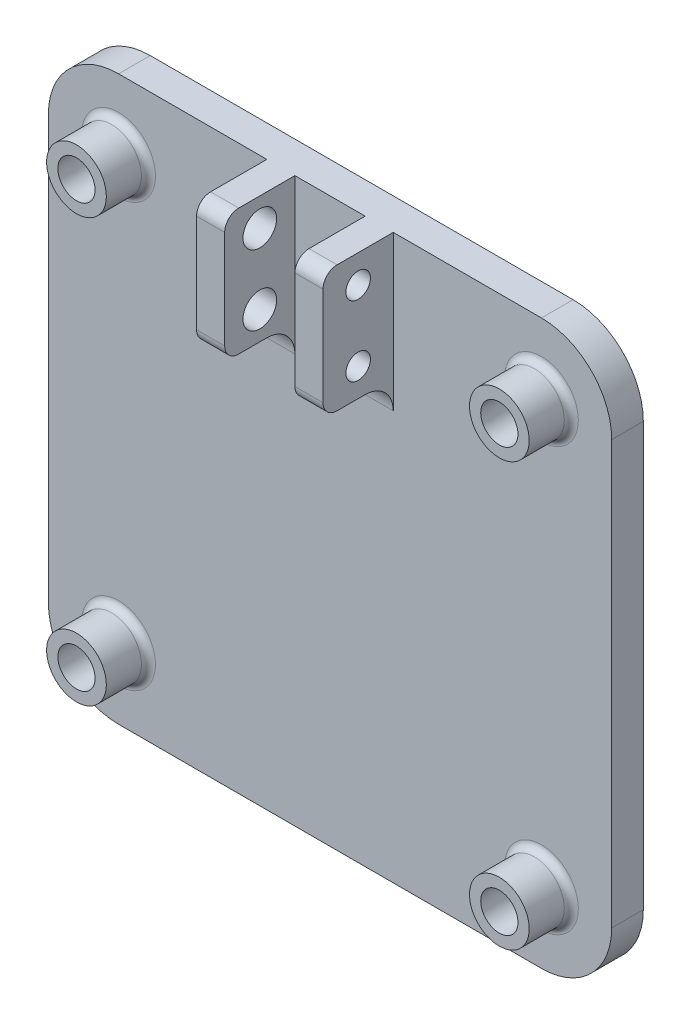
from build123d import *

# Parameters (mm, degrees)
SKETCH1_W            = 80.2
SKETCH1_H            = 80.2
BOSS_EXTRUDE1_DEPTH  = 4.5
M5_CLEARANCE_HOLE1_D = 5.3
FILLET1_R            = 10
SKETCH3_W            = 4
SKETCH3_H            = 18
BOSS_EXTRUDE2_DEPTH  = 10
CUT_EXTRUDE1_REACH   = 67.031
SKETCH5_R            = 1.75
CUT_EXTRUDE2_REACH   = 67.031
SKETCH6_R            = 2.4
FILLET2_R            = 2
FILLET3_R            = 4
BOSS_EXTRUDE3_START  = 6
SKETCH7_R            = 4.25
SKETCH7_R_2          = 2.65
BOSS_EXTRUDE3_DEPTH  = 6
FILLET5_R            = 1


with BuildPart() as part:
    # Sketch1 → Boss-Extrude1 (new body)
    with BuildSketch(Plane.XY):
        Rectangle(SKETCH1_W, SKETCH1_H)
    extrude(amount=BOSS_EXTRUDE1_DEPTH)

    # M5 Clearance Hole1 (through all)
    with Locations(Plane(origin=(30.1, 30.1, 0), x_dir=(-1, 0, 0), z_dir=(0, 0, -1))):
        with Locations((0, 0), (60.2, 0), (60.2, -60.2), (0, -60.2)):
            Hole(M5_CLEARANCE_HOLE1_D / 2)

    # Fillet1
    fillet1_edges = [part.edges().sort_by_distance(p)[0] for p in [
        (-40.1, 40.1, 2.25),
        (-40.1, -40.1, 2.25),
        (40.1, -40.1, 2.25),
        (40.1, 40.1, 2.25),
    ]]
    fillet(fillet1_edges, radius=FILLET1_R)

    # Sketch3 → Boss-Extrude2 (add)
    with BuildSketch(Plane.XY.offset(4.5)):
        with Locations((-7, 31.1)):
            Rectangle(SKETCH3_W, SKETCH3_H)
        with Locations((7, 31.1)):
            Rectangle(SKETCH3_W, SKETCH3_H)
    extrude(amount=BOSS_EXTRUDE2_DEPTH)

    # Sketch5 → Cut-Extrude1 (cut, up to next)
    with BuildSketch(Plane(origin=(9, 0, 0), x_dir=(0, 0, -1), z_dir=(1, 0, 0)), mode=Mode.PRIVATE) as cut_extrude1_sk1:
        with Locations((-9.5, 36.1)):
            Circle(SKETCH5_R)
    cut_extrude1_tool1 = extrude(cut_extrude1_sk1.sketch, amount=-CUT_EXTRUDE1_REACH, mode=Mode.PRIVATE) & part.part
    # Sketch5 → Cut-Extrude1 (cut, up to next)
    with BuildSketch(Plane(origin=(9, 0, 0), x_dir=(0, 0, -1), z_dir=(1, 0, 0)), mode=Mode.PRIVATE) as cut_extrude1_sk2:
        with Locations((-9.5, 26.1)):
            Circle(SKETCH5_R)
    cut_extrude1_tool2 = extrude(cut_extrude1_sk2.sketch, amount=-CUT_EXTRUDE1_REACH, mode=Mode.PRIVATE) & part.part
    add(cut_extrude1_tool1.solids().sort_by_distance((9, 36.1, 9.5))[0], mode=Mode.SUBTRACT)
    add(cut_extrude1_tool2.solids().sort_by_distance((9, 26.1, 9.5))[0], mode=Mode.SUBTRACT)

    # Sketch6 → Cut-Extrude2 (cut, up to next)
    with BuildSketch(Plane.ZY.offset(9), mode=Mode.PRIVATE) as cut_extrude2_sk1:
        with Locations((9.5, 36.1)):
            Circle(SKETCH6_R)
    cut_extrude2_tool1 = extrude(cut_extrude2_sk1.sketch, amount=-CUT_EXTRUDE2_REACH, mode=Mode.PRIVATE) & part.part
    # Sketch6 → Cut-Extrude2 (cut, up to next)
    with BuildSketch(Plane.ZY.offset(9), mode=Mode.PRIVATE) as cut_extrude2_sk2:
        with Locations((9.5, 26.1)):
            Circle(SKETCH6_R)
    cut_extrude2_tool2 = extrude(cut_extrude2_sk2.sketch, amount=-CUT_EXTRUDE2_REACH, mode=Mode.PRIVATE) & part.part
    add(cut_extrude2_tool1.solids().sort_by_distance((-9, 36.1, 9.5))[0], mode=Mode.SUBTRACT)
    add(cut_extrude2_tool2.solids().sort_by_distance((-9, 26.1, 9.5))[0], mode=Mode.SUBTRACT)

    # Fillet2
    fillet2_edges = [part.edges().sort_by_distance(p)[0] for p in [
        (-7, 22.1, 14.5),
        (7, 22.1, 14.5),
        (7, 40.1, 14.5),
        (-7, 40.1, 14.5),
    ]]
    fillet(fillet2_edges, radius=FILLET2_R)

    # Fillet3
    fillet3_edges = [part.edges().sort_by_distance(p)[0] for p in [
        (7, 22.1, 4.5),
        (-7, 22.1, 4.5),
    ]]
    fillet(fillet3_edges, radius=FILLET3_R)

    # Sketch7 → Boss-Extrude3 (add)
    # profile 1 of 4: a face of its own
    with BuildSketch(Plane.XY.offset(4.5).offset(BOSS_EXTRUDE3_START)):
        with Locations((-30.1, 30.1)):
            Circle(SKETCH7_R)
        with Locations((-30.1, 30.1)):
            Circle(SKETCH7_R_2, mode=Mode.SUBTRACT)
    # profile 2 of 4: a face of its own
    with BuildSketch(Plane.XY.offset(4.5).offset(BOSS_EXTRUDE3_START)):
        with Locations((30.1, 30.1)):
            Circle(SKETCH7_R)
        with Locations((30.1, 30.1)):
            Circle(SKETCH7_R_2, mode=Mode.SUBTRACT)
    # profile 3 of 4: a face of its own
    with BuildSketch(Plane.XY.offset(4.5).offset(BOSS_EXTRUDE3_START)):
        with Locations((30.1, -30.1)):
            Circle(SKETCH7_R)
        with Locations((30.1, -30.1)):
            Circle(SKETCH7_R_2, mode=Mode.SUBTRACT)
    # profile 4 of 4: a face of its own
    with BuildSketch(Plane.XY.offset(4.5).offset(BOSS_EXTRUDE3_START)):
        with Locations((-30.1, -30.1)):
            Circle(SKETCH7_R)
        with Locations((-30.1, -30.1)):
            Circle(SKETCH7_R_2, mode=Mode.SUBTRACT)
    extrude(amount=-BOSS_EXTRUDE3_DEPTH)

    # Fillet5
    fillet5_edges = [part.edges().sort_by_distance(p)[0] for p in [
        (25.85, 30.1, 4.5),
        (25.85, -30.1, 4.5),
        (-34.35, -30.1, 4.5),
        (-34.35, 30.1, 4.5),
    ]]
    fillet(fillet5_edges, radius=FILLET5_R)


solid = part.part
